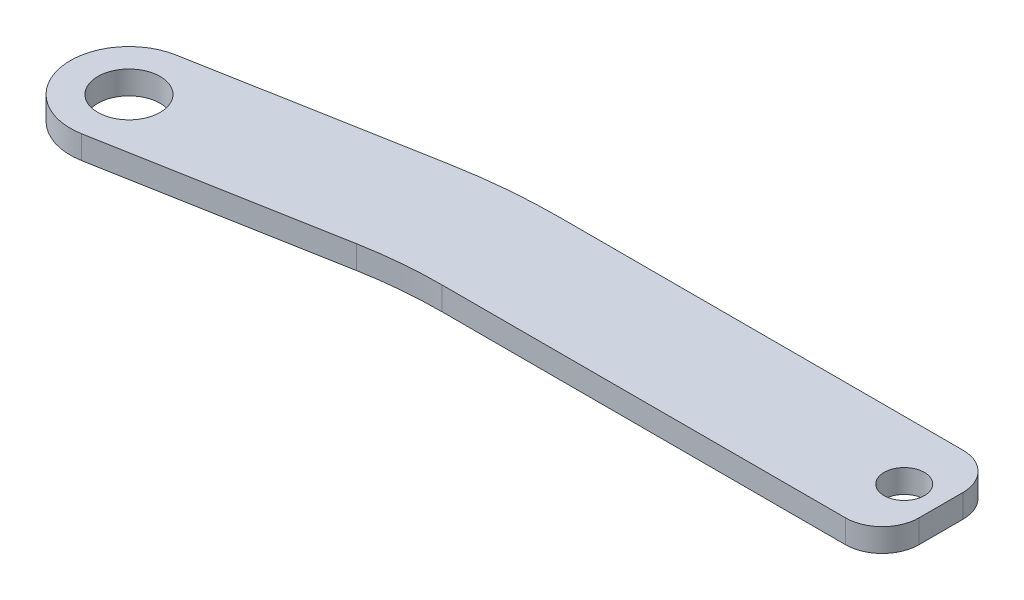
from build123d import *

# Parameters (mm, degrees)
SKETCH1_R           = 4.25
SKETCH1_R_2         = 2.75
BOSS_EXTRUDE1_DEPTH = 3.175


with BuildPart() as part:
    # Sketch1 → Boss-Extrude1 (new body)
    with BuildSketch(Plane(origin=(0, 0, 0), x_dir=(1, 0, 0), z_dir=(0, 1, 0))):
        with BuildLine():
            Line((-1.428652306, 7.871400929), (30.290003092, 13.628308828))
            ThreePointArc((30.290003092, 13.628308828), (37.048664607, 14.543961024), (43.8622, 14.85))
            Line((43.8622, 14.85), (98.8622, 14.85))
            ThreePointArc((98.8622, 14.85), (102.397733906, 13.385533906), (103.8622, 9.85))
            Line((103.8622, 9.85), (103.8622, 3.85))
            ThreePointArc((103.8622, 3.85), (102.397733906, 0.314466094), (98.8622, -1.15))
            Line((98.8622, -1.15), (43.8622, -1.15))
            ThreePointArc((43.8622, -1.15), (38.483093111, -1.391609718), (33.147307705, -2.114493031))
            Line((33.147307705, -2.114493031), (1.428652306, -7.871400929))
            ThreePointArc((1.428652306, -7.871400929), (-7.871400929, -1.428652306), (-1.428652306, 7.871400929))
        make_face()
        Circle(SKETCH1_R, mode=Mode.SUBTRACT)
        with Locations((98.8622, 6.85)):
            Circle(SKETCH1_R_2, mode=Mode.SUBTRACT)
    extrude(amount=BOSS_EXTRUDE1_DEPTH)


solid = part.part
